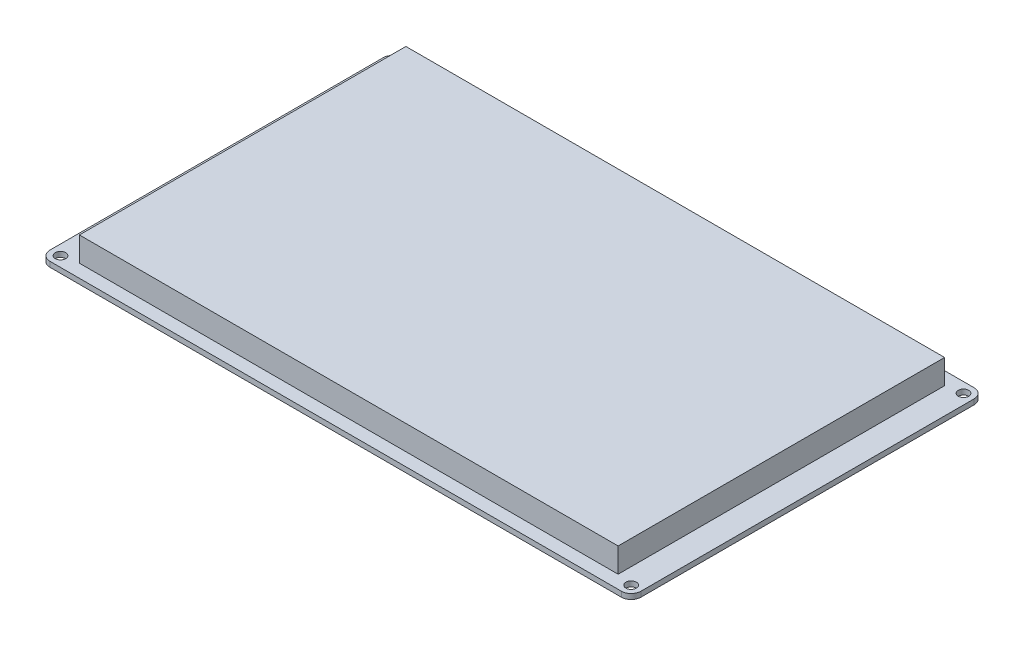
from build123d import *

# Parameters (mm, degrees)
SKETCH_1_R      = 1.6
EXTRUDE_1_DEPTH = 1.6
SKETCH_3_W      = 165
SKETCH_3_H      = 100
EXTRUDE_3_DEPTH = 7.5
SKETCH_4_W      = 8
SKETCH_4_H      = 15
EXTRUDE_4_DEPTH = 6
SKETCH_5_W      = 15
SKETCH_5_H      = 15
EXTRUDE_5_DEPTH = 2


with BuildPart() as part:
    # 草图1 → 凸台-拉伸1 (new body)
    with BuildSketch(Plane(origin=(0, 0, 0), x_dir=(1, 0, 0), z_dir=(0, 1, 0))):
        with BuildLine():
            ThreePointArc((-90.5, -51), (-89.621320344, -53.121320344), (-87.5, -54))
            Line((-87.5, -54), (87.5, -54))
            ThreePointArc((87.5, -54), (89.621320344, -53.121320344), (90.5, -51))
            Line((90.5, -51), (90.5, 51))
            ThreePointArc((90.5, 51), (89.621320344, 53.121320344), (87.5, 54))
            Line((87.5, 54), (-87.5, 54))
            ThreePointArc((-87.5, 54), (-89.621320344, 53.121320344), (-90.5, 51))
            Line((-90.5, 51), (-90.5, -51))
        make_face()
        with Locations((-87.4, -50.9)):
            Circle(SKETCH_1_R, mode=Mode.SUBTRACT)
        with Locations((87.4, -50.9)):
            Circle(SKETCH_1_R, mode=Mode.SUBTRACT)
        with Locations((-87.4, 50.9)):
            Circle(SKETCH_1_R, mode=Mode.SUBTRACT)
        with Locations((87.4, 50.9)):
            Circle(SKETCH_1_R, mode=Mode.SUBTRACT)
    extrude(amount=-EXTRUDE_1_DEPTH)

    # 草图3 → 凸台-拉伸3 (add)
    with BuildSketch(Plane(origin=(0, 0, 0), x_dir=(1, 0, 0), z_dir=(0, 1, 0))):
        Rectangle(SKETCH_3_W, SKETCH_3_H)
    extrude(amount=EXTRUDE_3_DEPTH)

    # 草图4 → 凸台-拉伸4 (add)
    with BuildSketch(Plane.XZ.offset(1.6)):
        with Locations((-86.5, 0)):
            Rectangle(SKETCH_4_W, SKETCH_4_H)
    extrude(amount=EXTRUDE_4_DEPTH)

    # 草图5 → 凸台-拉伸5 (add)
    with BuildSketch(Plane.XZ.offset(1.6)):
        with Locations((62, -46.5)):
            Rectangle(SKETCH_5_W, SKETCH_5_H)
    extrude(amount=EXTRUDE_5_DEPTH)


solid = part.part
